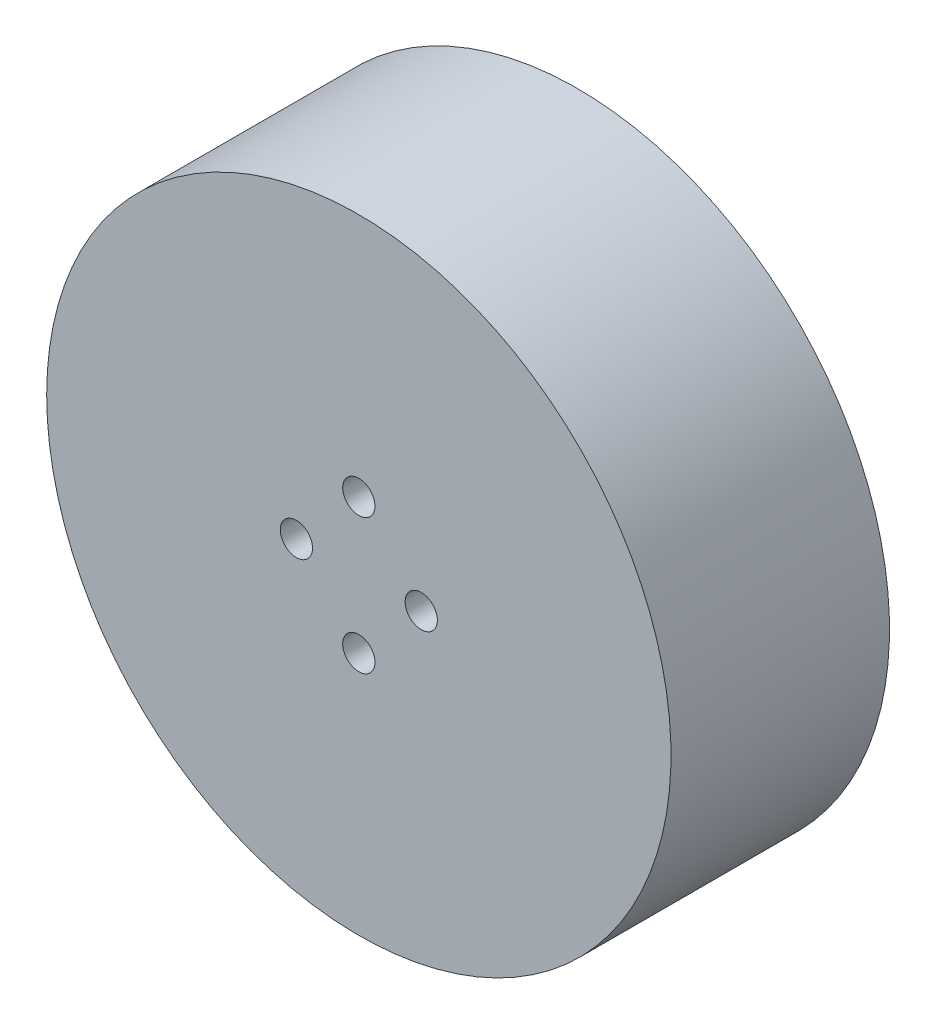
from build123d import *

# Parameters (mm, degrees)
SKETCH1_R           = 30
BOSS_EXTRUDE1_DEPTH = 10.5
SKETCH2_R           = 1.55
CUT_EXTRUDE1_DEPTH  = 10
SKETCH3_R           = 21
CUT_EXTRUDE2_DEPTH  = 17


with BuildPart() as part:
    # Sketch1 → Boss-Extrude1 (new, symmetric)
    with BuildSketch(Plane.XY):
        Circle(SKETCH1_R)
    extrude(amount=BOSS_EXTRUDE1_DEPTH, both=True)

    # Sketch2 → Cut-Extrude1 (cut)
    with BuildSketch(Plane.XY.offset(10.5)):
        with Locations((-6, 0)):
            Circle(SKETCH2_R)
        with Locations((0, 6.5)):
            Circle(SKETCH2_R)
        with Locations((6, 0)):
            Circle(SKETCH2_R)
        with Locations((0, -6.5)):
            Circle(SKETCH2_R)
    extrude(amount=-CUT_EXTRUDE1_DEPTH, mode=Mode.SUBTRACT)

    # Sketch3 → Cut-Extrude2 (cut)
    with BuildSketch(Plane(origin=(0, 0, -10.5), x_dir=(-1, 0, 0), z_dir=(0, 0, -1))):
        Circle(SKETCH3_R)
    extrude(amount=-CUT_EXTRUDE2_DEPTH, mode=Mode.SUBTRACT)


solid = part.part
